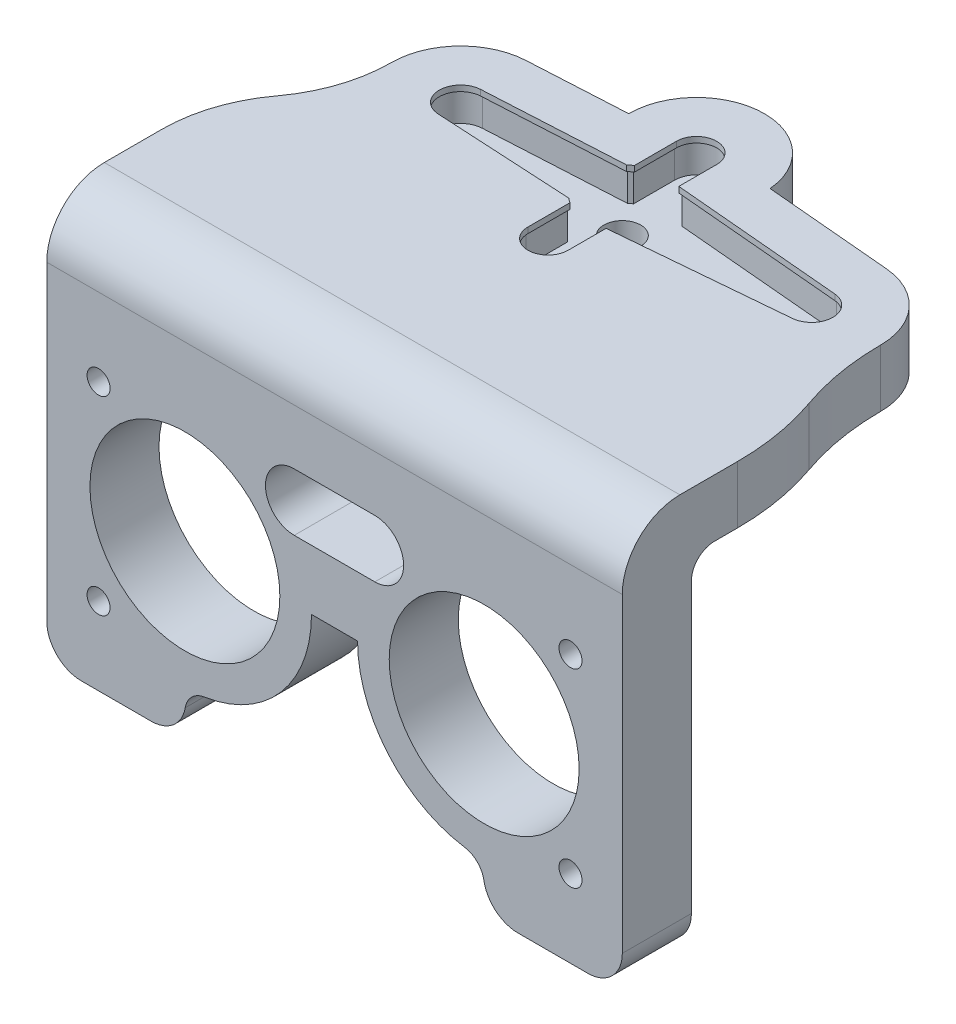
from build123d import *

# Parameters (mm, degrees)
EXTRUDE_THIN1_DEPTH = 5
BOSS_EXTRUDE1_DEPTH = 2
SKETCH3_R           = 1.6
CUT_EXTRUDE1_DEPTH  = 26.797771221
BOSS_EXTRUDE2_DEPTH = 5
SKETCH8_W           = 50
SKETCH8_H           = 6
BOSS_EXTRUDE6_DEPTH = 30
SKETCH10_R          = 8.25
SKETCH10_R_2        = 1
CUT_EXTRUDE2_DEPTH  = 55.037232534
FILLET2_R           = 5
FILLET4_R           = 3
EXTRUDE_THIN2_START = 4.5
EXTRUDE_THIN2_DEPTH = 0.5
FILLET5_R           = 2


# Read off the part's stored shape, not the designer's step: Extrude-Thin1, Boss-Extrude1, Extrude-Thin2
with BuildPart() as part:
    # Extrude-Thin1 outline → Extrude-Thin1 (new body)
    with BuildSketch(Plane(origin=(0, 0, 0), x_dir=(1, 0, 0), z_dir=(0, 1, 0))):
        with BuildLine():
            ThreePointArc((5.878005996, 6.958965141), (-0.252578975, 12.344591068), (-5.899998443, 6.454286146))
            Line((-5.899998443, 6.454286146), (-14.377365901, 5.991062641))
            ThreePointArc((-14.377365901, 5.991062641), (-20.05, 0), (-14.377365901, -5.991062641))
            Line((-14.377365901, -5.991062641), (-5.899998443, -6.454286146))
            ThreePointArc((-5.899998443, -6.454286146), (-0.252578975, -12.344591068), (5.878005996, -6.958965141))
            Line((5.878005996, -6.958965141), (16.97887538, -5.97664545))
            ThreePointArc((16.97887538, -5.97664545), (22.45, 0), (16.97887538, 5.97664545))
            Line((16.97887538, 5.97664545), (5.878005996, 6.958965141))
        make_face()
        with BuildLine():
            Line((-1.9, 2.87967012), (-1.9, 6.45))
            ThreePointArc((-1.9, 6.45), (0, 8.35), (1.9, 6.45))
            Line((1.9, 6.45), (1.9, 3.295349698))
            Line((1.9, 3.295349698), (16.626291793, 1.99221515))
            ThreePointArc((16.626291793, 1.99221515), (18.45, 0), (16.626291793, -1.99221515))
            Line((16.626291793, -1.99221515), (1.9, -3.295349698))
            Line((1.9, -3.295349698), (1.9, -6.45))
            ThreePointArc((1.9, -6.45), (0, -8.35), (-1.9, -6.45))
            Line((-1.9, -6.45), (-1.9, -2.87967012))
            ThreePointArc((-1.9, -2.87967012), (-2.057742861, -2.769150468), (-2.209072203, -2.65))
            Line((-2.209072203, -2.65), (-14.159121967, -1.99702088))
            ThreePointArc((-14.159121967, -1.99702088), (-16.05, 0), (-14.159121967, 1.99702088))
            Line((-14.159121967, 1.99702088), (-2.209072203, 2.65))
            ThreePointArc((-2.209072203, 2.65), (-2.057742861, 2.769150468), (-1.9, 2.87967012))
        make_face(mode=Mode.SUBTRACT)
    extrude(amount=EXTRUDE_THIN1_DEPTH)

    # Boss-Extrude1 outline → Boss-Extrude1 (add)
    with BuildSketch(Plane(origin=(0, 0, 0), x_dir=(1, 0, 0), z_dir=(0, 1, 0))):
        with BuildLine():
            ThreePointArc((1.9, 6.45), (0, 8.35), (-1.9, 6.45))
            Line((-1.9, 6.45), (-1.9, 2.87967012))
            ThreePointArc((-1.9, 2.87967012), (-2.057742861, 2.769150468), (-2.209072203, 2.65))
            Line((-2.209072203, 2.65), (-14.159121967, 1.99702088))
            ThreePointArc((-14.159121967, 1.99702088), (-16.05, 0), (-14.159121967, -1.99702088))
            Line((-14.159121967, -1.99702088), (-2.209072203, -2.65))
            ThreePointArc((-2.209072203, -2.65), (-2.057742861, -2.769150468), (-1.9, -2.87967012))
            Line((-1.9, -2.87967012), (-1.9, -6.45))
            ThreePointArc((-1.9, -6.45), (0, -8.35), (1.9, -6.45))
            Line((1.9, -6.45), (1.9, -3.295349698))
            Line((1.9, -3.295349698), (16.626291793, -1.99221515))
            ThreePointArc((16.626291793, -1.99221515), (18.45, 0), (16.626291793, 1.99221515))
            Line((16.626291793, 1.99221515), (1.9, 3.295349698))
            Line((1.9, 3.295349698), (1.9, 6.45))
        make_face()
    extrude(amount=BOSS_EXTRUDE1_DEPTH)

    # Sketch3 → Cut-Extrude1 (cut, through all)
    with BuildSketch(Plane(origin=(0, 2, 0), x_dir=(1, 0, 0), z_dir=(0, 1, 0))):
        with Locations(Location((0, 0, 0), (0, 0, 270))):
            Circle(SKETCH3_R)
    extrude(amount=-CUT_EXTRUDE1_DEPTH, mode=Mode.SUBTRACT)

    # Sketch4 → Boss-Extrude2 (add)
    # profile 1 of 2: a face of its own
    with BuildSketch(Plane.XZ):
        with BuildLine():
            Line((25, 25), (-25, 25))
            Line((-25, 25), (-25, 15))
            ThreePointArc((-25, 15), (-24.365263739, 11.051087966), (-22.525, 7.5))
            ThreePointArc((-22.525, 7.5), (-20.684736261, 3.948912034), (-20.05, 0))
            ThreePointArc((-20.05, 0), (-18.406844925, 4.125276027), (-14.377365901, 5.991062641))
            Line((-14.377365901, 5.991062641), (-5.899998443, 6.454286146))
            ThreePointArc((-5.899998443, 6.454286146), (-0.252578976, 12.344591068), (5.878005996, 6.958965141))
            Line((5.878005996, 6.958965141), (16.97887538, 5.97664545))
            ThreePointArc((16.97887538, 5.97664545), (20.875678043, 4.051342229), (22.45, 0))
            ThreePointArc((22.45, 0), (22.77102028, 3.803801552), (23.725, 7.5))
            ThreePointArc((23.725, 7.5), (24.67897972, 11.196198448), (25, 15))
            Line((25, 15), (25, 25))
        make_face()
    # profile 2 of 2: a face of its own
    with BuildSketch(Plane.XZ):
        with BuildLine():
            Line((-14.377365901, -5.991062641), (-5.899998443, -6.454286146))
            ThreePointArc((-5.899998443, -6.454286146), (-0.252578976, -12.344591068), (5.878005996, -6.958965141))
            Line((5.878005996, -6.958965141), (16.97887538, -5.97664545))
            ThreePointArc((16.97887538, -5.97664545), (22.45, 0), (16.97887538, 5.97664545))
            Line((16.97887538, 5.97664545), (5.878005996, 6.958965141))
            ThreePointArc((5.878005996, 6.958965141), (-0.252578976, 12.344591068), (-5.899998443, 6.454286146))
            Line((-5.899998443, 6.454286146), (-14.377365901, 5.991062641))
            ThreePointArc((-14.377365901, 5.991062641), (-20.05, 0), (-14.377365901, -5.991062641))
        make_face()
        with BuildLine():
            ThreePointArc((16.626291793, -1.99221515), (18.45, 0), (16.626291793, 1.99221515))
            Line((16.626291793, 1.99221515), (1.9, 3.295349698))
            Line((1.9, 3.295349698), (1.9, 6.45))
            ThreePointArc((1.9, 6.45), (0, 8.35), (-1.9, 6.45))
            Line((-1.9, 6.45), (-1.9, 2.87967012))
            ThreePointArc((-1.9, 2.87967012), (-2.057742862, 2.769150468), (-2.209072203, 2.65))
            Line((-2.209072203, 2.65), (-14.159121967, 1.99702088))
            ThreePointArc((-14.159121967, 1.99702088), (-16.05, 0), (-14.159121967, -1.99702088))
            Line((-14.159121967, -1.99702088), (-2.209072203, -2.65))
            ThreePointArc((-2.209072203, -2.65), (-2.057742862, -2.769150468), (-1.9, -2.87967012))
            Line((-1.9, -2.87967012), (-1.9, -6.45))
            ThreePointArc((-1.9, -6.45), (0, -8.35), (1.9, -6.45))
            Line((1.9, -6.45), (1.9, -3.295349698))
            Line((1.9, -3.295349698), (16.626291793, -1.99221515))
        make_face(mode=Mode.SUBTRACT)
    extrude(amount=-BOSS_EXTRUDE2_DEPTH)

    # Sketch8 → Boss-Extrude6 (add)
    with BuildSketch(Plane.XZ):
        with Locations((0, 22)):
            Rectangle(SKETCH8_W, SKETCH8_H)
    extrude(amount=BOSS_EXTRUDE6_DEPTH)

    # Sketch10 → Cut-Extrude2 (cut, through all)
    with BuildSketch(Plane.XY.offset(25)):
        with Locations((-13, -15)):
            Circle(SKETCH10_R)
        with Locations((13, -15)):
            Circle(SKETCH10_R)
        with Locations((20.5, -6.75)):
            Circle(SKETCH10_R_2)
        with Locations((20.5, -23.25)):
            Circle(SKETCH10_R_2)
        with Locations((-20.5, -23.25)):
            Circle(SKETCH10_R_2)
        with Locations((-20.5, -6.75)):
            Circle(SKETCH10_R_2)
        with BuildLine():
            Line((3.5, -9.8), (-3.5, -9.8))
            ThreePointArc((-3.5, -9.8), (-6, -7.3), (-3.5, -4.8))
            Line((-3.5, -4.8), (3.5, -4.8))
            ThreePointArc((3.5, -4.8), (6, -7.3), (3.5, -9.8))
        make_face()
        with BuildLine():
            Line((-2, -15), (2, -15))
            ThreePointArc((2, -15), (4.644900222, -22.154879991), (11.307692308, -25.869042951))
            ThreePointArc((11.307692308, -25.869042951), (12.519109051, -26.544345307), (13, -27.845232579))
            Line((13, -27.845232579), (13, -30))
            Line((13, -30), (-13, -30))
            Line((-13, -30), (-13, -27.845232579))
            ThreePointArc((-13, -27.845232579), (-12.519109051, -26.544345307), (-11.307692308, -25.869042951))
            ThreePointArc((-11.307692308, -25.869042951), (-4.644900222, -22.154879991), (-2, -15))
        make_face()
    extrude(amount=-CUT_EXTRUDE2_DEPTH, mode=Mode.SUBTRACT)

    # Fillet2
    fillet2_edges = [part.edges().sort_by_distance(p)[0] for p in [
        (0, 5, 25),
    ]]
    fillet(fillet2_edges, radius=FILLET2_R)

    # Fillet4
    fillet4_edges = [part.edges().sort_by_distance(p)[0] for p in [
        (25, -30, 22),
        (-25, -30, 22),
        (13, -30, 22),
        (-13, -30, 22),
    ]]
    fillet(fillet4_edges, radius=FILLET4_R)

    # Extrude-Thin2 outline → Extrude-Thin2 (add)
    with BuildSketch(Plane(origin=(0, 0, 0), x_dir=(1, 0, 0), z_dir=(0, 1, 0)).offset(EXTRUDE_THIN2_START)):
        with BuildLine():
            ThreePointArc((1.9, 6.45), (0, 8.35), (-1.9, 6.45))
            Line((-1.9, 6.45), (-1.9, 2.87967012))
            ThreePointArc((-1.9, 2.87967012), (-2.057742861, 2.769150468), (-2.209072203, 2.65))
            Line((-2.209072203, 2.65), (-14.159121967, 1.99702088))
            ThreePointArc((-14.159121967, 1.99702088), (-16.05, 0), (-14.159121967, -1.99702088))
            Line((-14.159121967, -1.99702088), (-2.209072203, -2.65))
            ThreePointArc((-2.209072203, -2.65), (-2.057742861, -2.769150468), (-1.9, -2.87967012))
            Line((-1.9, -2.87967012), (-1.9, -6.45))
            ThreePointArc((-1.9, -6.45), (0, -8.35), (1.9, -6.45))
            Line((1.9, -6.45), (1.9, -3.295349698))
            Line((1.9, -3.295349698), (16.626291793, -1.99221515))
            ThreePointArc((16.626291793, -1.99221515), (18.45, 0), (16.626291793, 1.99221515))
            Line((16.626291793, 1.99221515), (1.9, 3.295349698))
            Line((1.9, 3.295349698), (1.9, 6.45))
        make_face()
        with BuildLine():
            ThreePointArc((-1.75, -2.797766967), (-1.955868768, -2.657927268), (-2.150613493, -2.502970556))
            Line((-2.150613493, -2.502970556), (-14.15093782, -1.847244314))
            ThreePointArc((-14.15093782, -1.847244314), (-15.9, 0), (-14.15093782, 1.847244314))
            Line((-14.15093782, 1.847244314), (-2.150613493, 2.502970556))
            ThreePointArc((-2.150613493, 2.502970556), (-1.955868768, 2.657927268), (-1.75, 2.797766967))
            Line((-1.75, 2.797766967), (-1.75, 6.45))
            ThreePointArc((-1.75, 6.45), (0, 8.2), (1.75, 6.45))
            Line((1.75, 6.45), (1.75, 3.158037104))
            Line((1.75, 3.158037104), (16.613069909, 1.842799014))
            ThreePointArc((16.613069909, 1.842799014), (18.3, 0), (16.613069909, -1.842799014))
            Line((16.613069909, -1.842799014), (1.75, -3.158037104))
            Line((1.75, -3.158037104), (1.75, -6.45))
            ThreePointArc((1.75, -6.45), (0, -8.2), (-1.75, -6.45))
            Line((-1.75, -6.45), (-1.75, -2.797766967))
        make_face(mode=Mode.SUBTRACT)
    extrude(amount=EXTRUDE_THIN2_DEPTH)

    # Fillet5
    fillet5_edges = [part.edges().sort_by_distance(p)[0] for p in [
        (0, 0, 19),
    ]]
    fillet(fillet5_edges, radius=FILLET5_R)


solid = part.part
